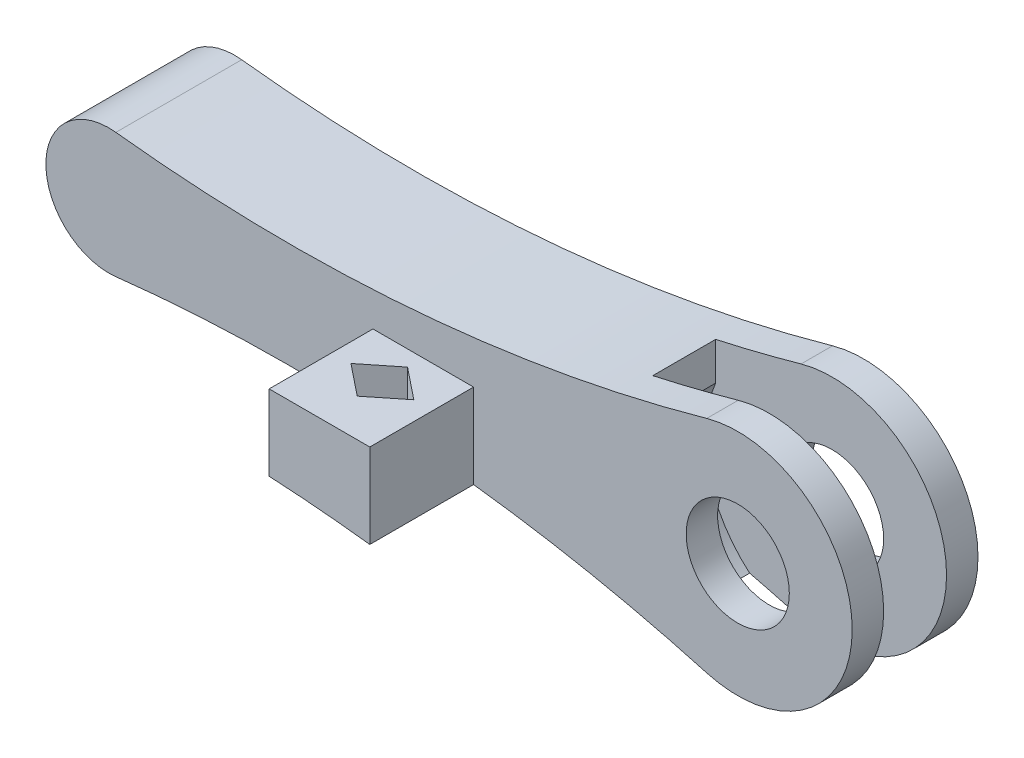
from build123d import *

# Parameters (mm, degrees)
ESQUISSE1_R             = 4.1
BOSS_EXTRU_1_DEPTH      = 5
ESQUISSE2_R             = 10.1
ENL_V_MAT_EXTRU_1_DEPTH = 2.5
BOSS_EXTRU_2_START      = 8.25
BOSS_EXTRU_2_DEPTH      = 8.25
ENL_V_MAT_EXTRU_2_DEPTH = 58.586020219
CHANFREIN1_START        = -2.5
CHANFREIN1_DEPTH        = 5


with BuildPart() as part:
    # Esquisse1 → Boss.-Extru.1 (new, symmetric)
    with BuildSketch(Plane(origin=(0, 0, 0), x_dir=(0, 1, 0), z_dir=(0, 0, 1))):
        with BuildLine():
            ThreePointArc((-8.760260026, 2.463299468), (0, -9.1), (8.760260026, 2.463299468))
            ThreePointArc((8.760260026, 2.463299468), (4.584088783, 25.765676228), (4.968111267, 49.4362))
            ThreePointArc((4.968111267, 49.4362), (0, 55), (-4.968111267, 49.4362))
            ThreePointArc((-4.968111267, 49.4362), (-4.584088783, 25.765676228), (-8.760260026, 2.463299468))
        make_face()
        with Locations(Location((0, 0, 0), (0, 0, 270))):
            Circle(ESQUISSE1_R, mode=Mode.SUBTRACT)
    extrude(amount=BOSS_EXTRU_1_DEPTH, both=True)

    # Esquisse2 → Enlèv. mat.-Extru.1 (cut, symmetric)
    with BuildSketch(Plane(origin=(0, 0, 0), x_dir=(0, 1, 0), z_dir=(0, 0, 1))):
        Circle(ESQUISSE2_R)
    extrude(amount=ENL_V_MAT_EXTRU_1_DEPTH, both=True, mode=Mode.SUBTRACT)

    # Esquisse3 → Boss.-Extru.2 (add)
    with BuildSketch(Plane.XY.offset(5).offset(BOSS_EXTRU_2_START)):
        with BuildLine():
            Line((-29, 1.651149925), (-29, -4.366011007))
            ThreePointArc((-29, -4.366011007), (-24.994289146, -4.648817083), (-21, -5.062765073))
            Line((-21, -5.062765073), (-21, 1.651149925))
            Line((-21, 1.651149925), (-29, 1.651149925))
        make_face()
    extrude(amount=-BOSS_EXTRU_2_DEPTH)

    # Esquisse4 → Enlèv. mat.-Extru.2 (cut, through all)
    with BuildSketch(Plane(origin=(0, 1.651149925, 0), x_dir=(-1, 0, 0), z_dir=(0, 1, 0))):
        Polygon((22.500084499, 8.25), (25, 10.25), (27.499915501, 8.25), (25, 6.25), align=None)
    extrude(amount=-ENL_V_MAT_EXTRU_2_DEPTH, mode=Mode.SUBTRACT)

    # Chanfrein1: read off the stored shape, not the designer's step
    # Chanfrein1 outline → Chanfrein1 (cut)
    with BuildSketch(Plane.XY.offset(CHANFREIN1_START)):
        with BuildLine():
            ThreePointArc((-6.552176852, 7.68628509), (-7.902187824, 7.364580252), (-9.255756722, 7.058190199))
            Line((-9.255756722, 7.058190199), (-9.253811974, 4.046846174))
            ThreePointArc((-9.253811974, 4.046846174), (-8.109790355, 6.020074784), (-6.552176852, 7.68628509))
        make_face()
    extrude(amount=CHANFREIN1_DEPTH, mode=Mode.SUBTRACT)


solid = part.part
